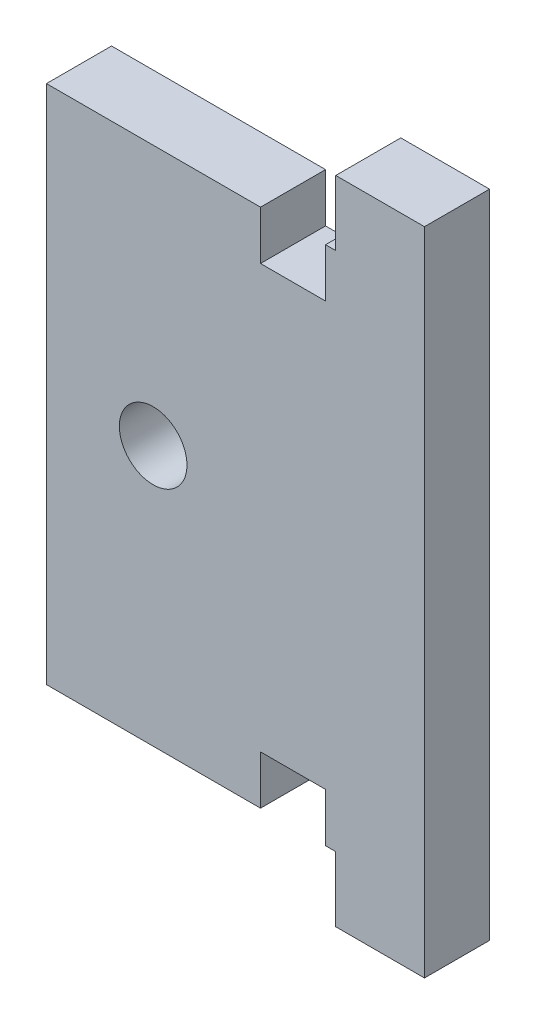
from build123d import *

# Parameters (mm, degrees)
SKETCH2_W               = 43.942
SKETCH2_H               = 127
BOSS_EXTRUDE1_DEPTH     = 6.35
M6_CLEARANCE_HOLE1_D    = 6.6
CUT_EXTRUDE1_DEPTH      = 135.537065019
CUT_EXTRUDE1_DEPTH_BACK = 135.537065019
SKETCH5_W               = 7.0505
SKETCH5_H               = 127
SKETCH6_W               = 28.23137
SKETCH6_H               = 6.35
SKETCH6_H_2             = 9.525
CUT_EXTRUDE2_DEPTH      = 135.537065019
SKETCH7_W               = 6.35
SKETCH7_H               = 4.7625
CUT_EXTRUDE3_DEPTH      = 135.537065019
CUT_EXTRUDE4_DEPTH      = 135.537065019
CUT_EXTRUDE4_DEPTH_BACK = 135.537065019
SKETCH8_R               = 3.3


with BuildPart() as part:
    # Sketch2 → Boss-Extrude1 (new body)
    with BuildSketch(Plane.XY):
        with Locations((21.971, 63.5)):
            Rectangle(SKETCH2_W, SKETCH2_H)
    extrude(amount=BOSS_EXTRUDE1_DEPTH)

    # M6 Clearance Hole1 (through all)
    with Locations(Plane.XY.offset(6.35)):
        with Locations((17.4625, 31.75), (17.4625, 95.25)):
            Hole(M6_CLEARANCE_HOLE1_D / 2)

    # Sketch5 → Cut-Extrude1 (cut, two sides: drawn at the far end of the back side and taken through both)
    with BuildSketch(Plane.XY.offset(6.35).offset(-CUT_EXTRUDE1_DEPTH_BACK)):
        with Locations((3.52525, 63.5)):
            Rectangle(SKETCH5_W, SKETCH5_H)
    extrude(amount=CUT_EXTRUDE1_DEPTH + CUT_EXTRUDE1_DEPTH_BACK, mode=Mode.SUBTRACT)

    # Sketch6 → Cut-Extrude2 (cut, through all)
    with BuildSketch(Plane.XY.offset(6.35)):
        with Locations((21.166185, 123.825)):
            Rectangle(SKETCH6_W, SKETCH6_H)
        with Locations((21.166185, 61.9125)):
            Rectangle(SKETCH6_W, SKETCH6_H_2)
        with Locations((21.166185, 3.175)):
            Rectangle(SKETCH6_W, SKETCH6_H)
    extrude(amount=-CUT_EXTRUDE2_DEPTH, mode=Mode.SUBTRACT)

    # Sketch7 → Cut-Extrude3 (cut, through all)
    with BuildSketch(Plane.XY.offset(6.35)):
        with Locations((31.115, 118.26875)):
            Rectangle(SKETCH7_W, SKETCH7_H)
        with Locations((31.115, 69.05625)):
            Rectangle(SKETCH7_W, SKETCH7_H)
        with Locations((31.115, 54.76875)):
            Rectangle(SKETCH7_W, SKETCH7_H)
        with Locations((31.115, 8.73125)):
            Rectangle(SKETCH7_W, SKETCH7_H)
    extrude(amount=-CUT_EXTRUDE3_DEPTH, mode=Mode.SUBTRACT)

    # Sketch8 → Cut-Extrude4 (cut, two sides: drawn at the far end of the back side and taken through both)
    with BuildSketch(Plane.XY.offset(6.35).offset(-CUT_EXTRUDE4_DEPTH_BACK)):
        Polygon((35.28187, 66.675), (35.28187, 63.5), (43.942, 63.5), (43.942, 127), (35.28187, 127), (35.28187, 120.65), (34.29, 120.65), (34.29, 115.8875), (27.94, 115.8875), (27.94, 120.65), (7.0505, 120.65), (7.0505, 66.675), (27.94, 66.675), (27.94, 71.4375), (34.29, 71.4375), (34.29, 66.675), align=None)
        with Locations((17.4625, 95.25)):
            Circle(SKETCH8_R, mode=Mode.SUBTRACT)
    extrude(amount=CUT_EXTRUDE4_DEPTH + CUT_EXTRUDE4_DEPTH_BACK, mode=Mode.SUBTRACT)


solid = part.part
